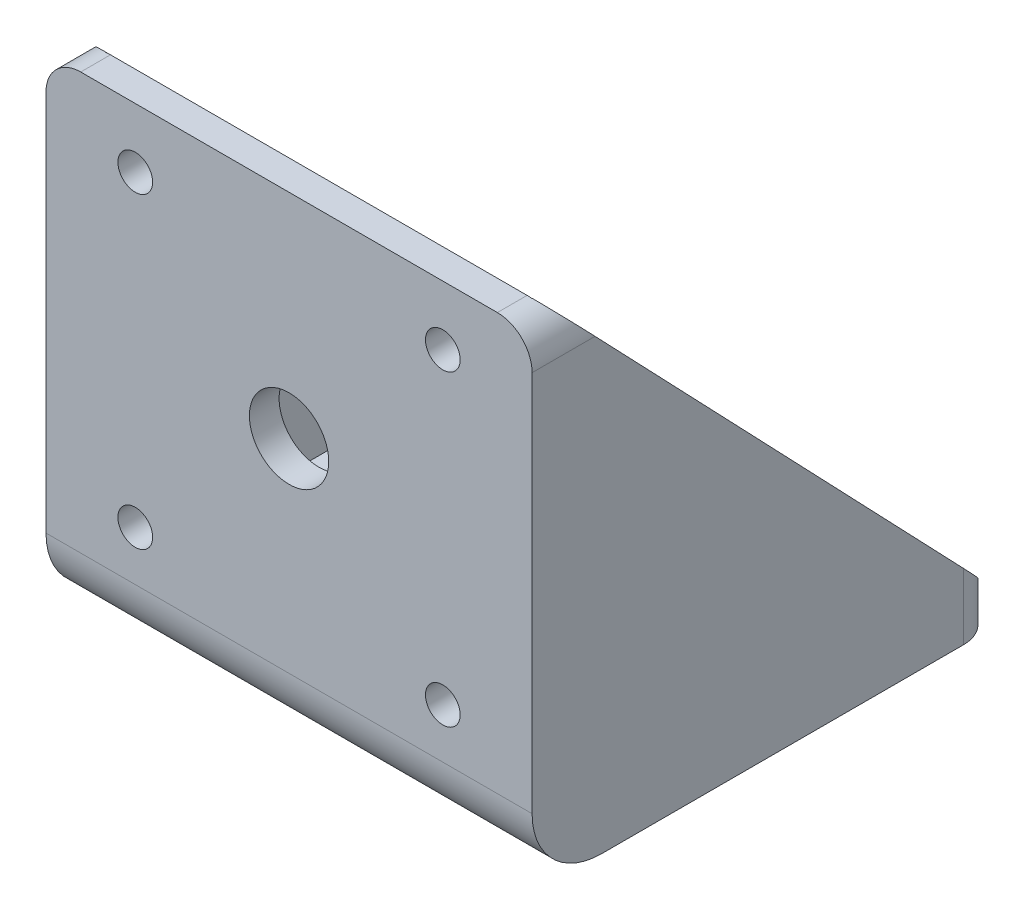
from build123d import *

# Parameters (mm, degrees)
ESBO_O1_W                = 43
ESBO_O1_H                = 47
RESSALTO_EXTRUS_O1_DEPTH = 3
ESBO_O2_W                = 43
ESBO_O2_H                = 3
RESSALTO_EXTRUS_O2_DEPTH = 46
ESBO_O3_R                = 1.75
CORTE_EXTRUS_O1_DEPTH    = 56.950871307
ESBO_O4_R                = 1.75
CORTE_EXTRUS_O2_DEPTH    = 72.219730412
RESSALTO_EXTRUS_O3_DEPTH = 3
RESSALTO_EXTRUS_O4_DEPTH = 3
ESBO_O7_R                = 4
CORTE_EXTRUS_O3_DEPTH    = 3
FILETE1_R                = 3.5
FILETE2_R                = 7
FILETE3_R                = 3.5
FILETE4_R                = 5


with BuildPart() as part:
    # Esboço1 → Ressalto-extrusão1 (new body)
    with BuildSketch(Plane(origin=(0, 0, 0), x_dir=(1, 0, 0), z_dir=(0, 1, 0))):
        Rectangle(ESBO_O1_W, ESBO_O1_H)
    extrude(amount=RESSALTO_EXTRUS_O1_DEPTH)

    # Esboço2 → Ressalto-extrusão2 (add)
    with BuildSketch(Plane(origin=(0, 3, 0), x_dir=(1, 0, 0), z_dir=(0, 1, 0))):
        with Locations((0, -22)):
            Rectangle(ESBO_O2_W, ESBO_O2_H)
    extrude(amount=RESSALTO_EXTRUS_O2_DEPTH)

    # Esboço3 → Corte-extrusão1 (cut, through all)
    with BuildSketch(Plane(origin=(0, 3, 0), x_dir=(1, 0, 0), z_dir=(0, 1, 0))):
        with Locations(Location((14.945, 12.03, 0), (0, 0, 270))):
            Circle(ESBO_O3_R)
        with Locations(Location((14.945, -12.03, 0), (0, 0, 90))):
            Circle(ESBO_O3_R)
        with Locations(Location((-14.945, -12.03, 0), (0, 0, 270))):
            Circle(ESBO_O3_R)
        with Locations(Location((-14.945, 12.03, 0), (0, 0, 90))):
            Circle(ESBO_O3_R)
    extrude(amount=-CORTE_EXTRUS_O1_DEPTH, mode=Mode.SUBTRACT)

    # Esboço4 → Corte-extrusão2 (cut, through all)
    with BuildSketch(Plane.XY.offset(23.5)):
        with Locations((-15.5, 43)):
            Circle(ESBO_O4_R)
        with Locations((15.5, 43)):
            Circle(ESBO_O4_R)
        with Locations((-15.5, 12)):
            Circle(ESBO_O4_R)
        with Locations((15.5, 12)):
            Circle(ESBO_O4_R)
    extrude(amount=-CORTE_EXTRUS_O2_DEPTH, mode=Mode.SUBTRACT)

    # Esboço5 → Ressalto-extrusão3 (add)
    with BuildSketch(Plane.ZY.offset(21.5)):
        Polygon((-23.5, 0), (-23.5, 3), (20.5, 49), (23.5, 49), (23.5, 0), align=None)
    extrude(amount=RESSALTO_EXTRUS_O3_DEPTH)

    # Esboço6 → Ressalto-extrusão4 (add)
    with BuildSketch(Plane(origin=(21.5, 0, 0), x_dir=(0, 0, -1), z_dir=(1, 0, 0))):
        Polygon((23.5, 0), (-23.5, 0), (-23.5, 49), (-20.5, 49), (23.5, 3), align=None)
    extrude(amount=RESSALTO_EXTRUS_O4_DEPTH)

    # Esboço7 → Corte-extrusão3 (cut)
    with BuildSketch(Plane.XY.offset(23.5)):
        with Locations((0, 27.5)):
            Circle(ESBO_O7_R)
    extrude(amount=-CORTE_EXTRUS_O3_DEPTH, mode=Mode.SUBTRACT)

    # Filete1
    # the kernel refuses this fillet: 3.5 mm, written as the material it takes off along each edge
    with BuildSketch(Plane(origin=(-24.5, 49, 11.75), x_dir=(1, 0, 0), z_dir=(0, 0, 1)), Plane(origin=(24.5, 49, 32.25), x_dir=(-1, 0, 0), z_dir=(0, 0, -1))) as filete1_piece_1:
        with BuildLine():
            CenterArc((FILETE1_R, -FILETE1_R), FILETE1_R, 90, 90)
            Line((0, -FILETE1_R), (0, 0))
            Line((0, 0), (FILETE1_R, 0))
        make_face()
    extrude(amount=20.5, mode=Mode.SUBTRACT)

    # Filete2
    filete2_edges = [part.edges().sort_by_distance(p)[0] for p in [
        (0, 0, 23.5),
    ]]
    fillet(filete2_edges, radius=FILETE2_R)

    # Filete3
    # the kernel refuses this fillet: 3.5 mm, written as the material it takes off along each edge
    with BuildSketch(Plane(origin=(-24.5, -8.75, -23.5), x_dir=(0, 0, 1), z_dir=(0, 1, 0)), Plane(origin=(24.5, 11.75, -23.5), x_dir=(0, 0, 1), z_dir=(0, -1, 0))) as filete3_piece_1:
        with BuildLine():
            CenterArc((FILETE3_R, FILETE3_R), FILETE3_R, 180, 90)
            Line((0, FILETE3_R), (0, 0))
            Line((0, 0), (FILETE3_R, 0))
        make_face()
    extrude(amount=20.5, mode=Mode.SUBTRACT)

    # Filete4
    filete4_edges = [part.edges().sort_by_distance(p)[0] for p in [
        (0, 3, 20.5),
    ]]
    fillet(filete4_edges, radius=FILETE4_R)


solid = part.part
